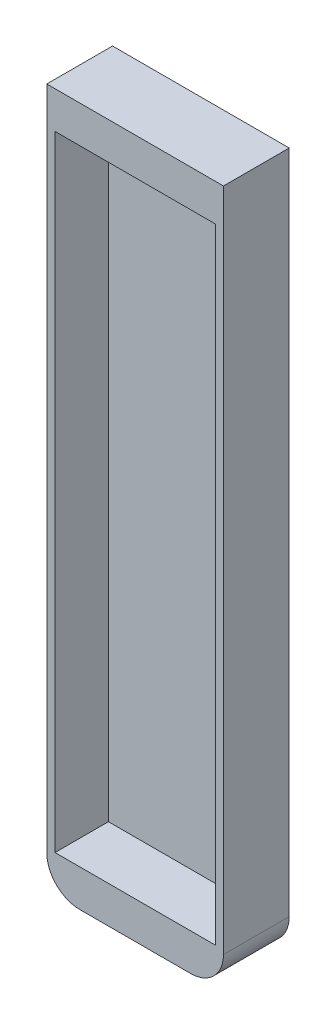
from build123d import *

# Parameters (mm, degrees)
SKETCH_1_W          = 43
SKETCH_1_H          = 170
EXTRUDE_1_DEPTH     = 16
SKETCH_3_W          = 39
SKETCH_3_H          = 152
CUT_EXTRUDE_1_DEPTH = 13
FILLET_3_R          = 8


with BuildPart() as part:
    # Эскиз1 → Бобышка-Вытянуть1 (new body)
    with BuildSketch(Plane.XY):
        with Locations((21.5, 85)):
            Rectangle(SKETCH_1_W, SKETCH_1_H)
    extrude(amount=EXTRUDE_1_DEPTH)

    # Эскиз3 → Вырез-Вытянуть1 (cut)
    with BuildSketch(Plane.XY.offset(16)):
        with Locations((21.5, 85)):
            Rectangle(SKETCH_3_W, SKETCH_3_H)
    extrude(amount=-CUT_EXTRUDE_1_DEPTH, mode=Mode.SUBTRACT)

    # Скругление3
    fillet_3_edges = [part.edges().sort_by_distance(p)[0] for p in [
        (43, 0, 8),
        (0, 0, 8),
    ]]
    fillet(fillet_3_edges, radius=FILLET_3_R)


solid = part.part
